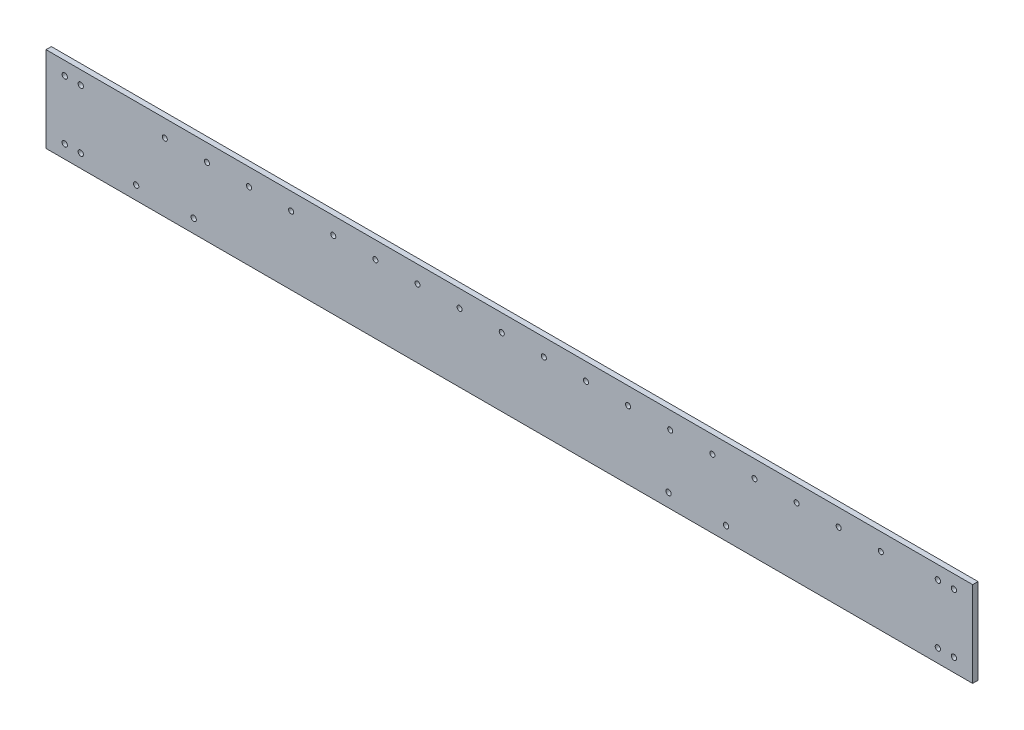
from build123d import *

# Parameters (mm, degrees)
SKETCH1_W                        = 3.175
SKETCH1_H                        = 50.8
BOSS_EXTRUDE1_DEPTH              = 550
LEFTSIDEHOLES_SKETCH4_R          = 1.5875
LEFTSIDEHOLES_SKETCH4_R_2        = 1.5
LEFTSIDEHOLES_CUT_EXTRUDE3_DEPTH = 553.350179347


with BuildPart() as part:
    # Sketch1 → Boss-Extrude1 (new body)
    with BuildSketch(Plane(origin=(0, 0, 0), x_dir=(0, 0, -1), z_dir=(1, 0, 0))):
        with Locations((-1.5875, 25.4)):
            Rectangle(SKETCH1_W, SKETCH1_H)
    extrude(amount=BOSS_EXTRUDE1_DEPTH)

    # LeftSideHoles-Sketch4 → LeftSideHoles-Cut-Extrude3 (cut, through all)
    with BuildSketch(Plane.XY.offset(3.175)):
        with Locations((11.1125, 42.8625)):
            Circle(LEFTSIDEHOLES_SKETCH4_R)
        with Locations((529.3625, 42.8625)):
            Circle(LEFTSIDEHOLES_SKETCH4_R)
        with Locations((20.6375, 42.8625)):
            Circle(LEFTSIDEHOLES_SKETCH4_R)
        with Locations((538.8875, 42.8625)):
            Circle(LEFTSIDEHOLES_SKETCH4_R)
        with Locations((11.1125, 7.9375)):
            Circle(LEFTSIDEHOLES_SKETCH4_R)
        with Locations((20.6375, 7.9375)):
            Circle(LEFTSIDEHOLES_SKETCH4_R)
        with Locations((529.3625, 7.9375)):
            Circle(LEFTSIDEHOLES_SKETCH4_R)
        with Locations((538.8875, 7.9375)):
            Circle(LEFTSIDEHOLES_SKETCH4_R)
        with Locations((495.5, 40.575)):
            Circle(LEFTSIDEHOLES_SKETCH4_R_2)
        with Locations((470.5, 40.575)):
            Circle(LEFTSIDEHOLES_SKETCH4_R_2)
        with Locations((445.5, 40.575)):
            Circle(LEFTSIDEHOLES_SKETCH4_R_2)
        with Locations((420.5, 40.575)):
            Circle(LEFTSIDEHOLES_SKETCH4_R_2)
        with Locations((395.5, 40.575)):
            Circle(LEFTSIDEHOLES_SKETCH4_R_2)
        with Locations((370.5, 40.575)):
            Circle(LEFTSIDEHOLES_SKETCH4_R_2)
        with Locations((345.5, 40.575)):
            Circle(LEFTSIDEHOLES_SKETCH4_R_2)
        with Locations((320.5, 40.575)):
            Circle(LEFTSIDEHOLES_SKETCH4_R_2)
        with Locations((295.5, 40.575)):
            Circle(LEFTSIDEHOLES_SKETCH4_R_2)
        with Locations((270.5, 40.575)):
            Circle(LEFTSIDEHOLES_SKETCH4_R_2)
        with Locations((245.5, 40.575)):
            Circle(LEFTSIDEHOLES_SKETCH4_R_2)
        with Locations((220.5, 40.575)):
            Circle(LEFTSIDEHOLES_SKETCH4_R_2)
        with Locations((195.5, 40.575)):
            Circle(LEFTSIDEHOLES_SKETCH4_R_2)
        with Locations((170.5, 40.575)):
            Circle(LEFTSIDEHOLES_SKETCH4_R_2)
        with Locations((145.5, 40.575)):
            Circle(LEFTSIDEHOLES_SKETCH4_R_2)
        with Locations((120.5, 40.575)):
            Circle(LEFTSIDEHOLES_SKETCH4_R_2)
        with Locations((95.5, 40.575)):
            Circle(LEFTSIDEHOLES_SKETCH4_R_2)
        with Locations((70.5, 40.575)):
            Circle(LEFTSIDEHOLES_SKETCH4_R_2)
        with Locations((53.5125, 7.9375)):
            Circle(LEFTSIDEHOLES_SKETCH4_R)
        with Locations((369.5125, 7.9375)):
            Circle(LEFTSIDEHOLES_SKETCH4_R)
        with Locations((87.6375, 7.9375)):
            Circle(LEFTSIDEHOLES_SKETCH4_R)
        with Locations((403.6375, 7.9375)):
            Circle(LEFTSIDEHOLES_SKETCH4_R)
    extrude(amount=-LEFTSIDEHOLES_CUT_EXTRUDE3_DEPTH, mode=Mode.SUBTRACT)


solid = part.part
